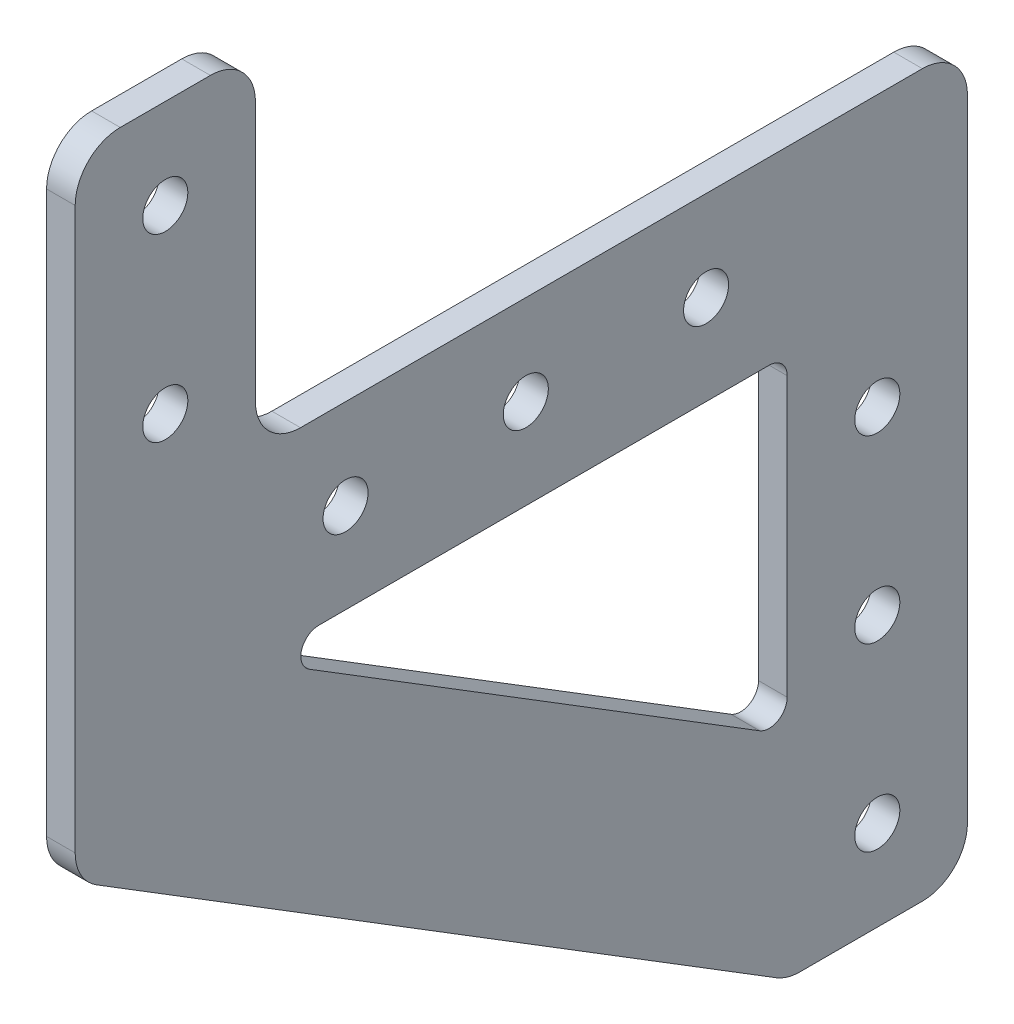
from build123d import *
from OCP.BRepFilletAPI import BRepFilletAPI_MakeFillet

# Parameters (mm, degrees)
SKETCH2_R           = 2.5
BOSS_EXTRUDE1_DEPTH = 3.175
FILLET1_R1          = 5
FILLET1_R2          = 2


with BuildPart() as part:
    # Sketch2 → Boss-Extrude1 (new body)
    with BuildSketch(Plane(origin=(0, 0, 0), x_dir=(0, 0, -1), z_dir=(1, 0, 0))):
        Polygon((-49.5, 48.852623411), (-29.5, 48.852623411), (-29.5, 10), (49.5, 10), (49.5, -70), (29.5, -70), (-49.5, -21.147376589), align=None)
        with Locations((-39.5, 38.852623411)):
            Circle(SKETCH2_R, mode=Mode.SUBTRACT)
        with Locations((-39.5, 18.852623411)):
            Circle(SKETCH2_R, mode=Mode.SUBTRACT)
        with Locations((39.5, -60)):
            Circle(SKETCH2_R, mode=Mode.SUBTRACT)
        with Locations((39.5, -40)):
            Circle(SKETCH2_R, mode=Mode.SUBTRACT)
        with Locations((39.5, -20)):
            Circle(SKETCH2_R, mode=Mode.SUBTRACT)
        with Locations((-19.5, 0)):
            Circle(SKETCH2_R, mode=Mode.SUBTRACT)
        with Locations((0.5, 0)):
            Circle(SKETCH2_R, mode=Mode.SUBTRACT)
        with Locations((20.5, 0)):
            Circle(SKETCH2_R, mode=Mode.SUBTRACT)
        Polygon((29.5, -46.484870649), (29.5, -10), (-29.5, -10), align=None, mode=Mode.SUBTRACT)
    extrude(amount=BOSS_EXTRUDE1_DEPTH)

    # Fillet1: one fillet with a radius per group of edges: ONE call of the kernel's fillet builder (fillet() takes one radius for all edges)
    fillet1_edges_1 = [part.edges().sort_by_distance(p)[0] for p in [
        (1.5875, 48.852623411, 49.5),
        (1.5875, 48.852623411, 29.5),
        (1.5875, 10, 29.5),
        (1.5875, 10, -49.5),
        (1.5875, -70, -49.5),
        (1.5875, -70, -29.5),
        (1.5875, -21.147376589, 49.5),
    ]]
    fillet1_edges_2 = [part.edges().sort_by_distance(p)[0] for p in [
        (1.5875, -10, -29.5),
        (1.5875, -10, 29.5),
        (1.5875, -46.484870649, -29.5),
    ]]
    fillet1 = BRepFilletAPI_MakeFillet(part.part.solid().wrapped)
    for e in fillet1_edges_1:
        fillet1.Add(FILLET1_R1, e.wrapped)
    for e in fillet1_edges_2:
        fillet1.Add(FILLET1_R2, e.wrapped)
    add(Compound.cast(fillet1.Shape()), mode=Mode.REPLACE)


solid = part.part
